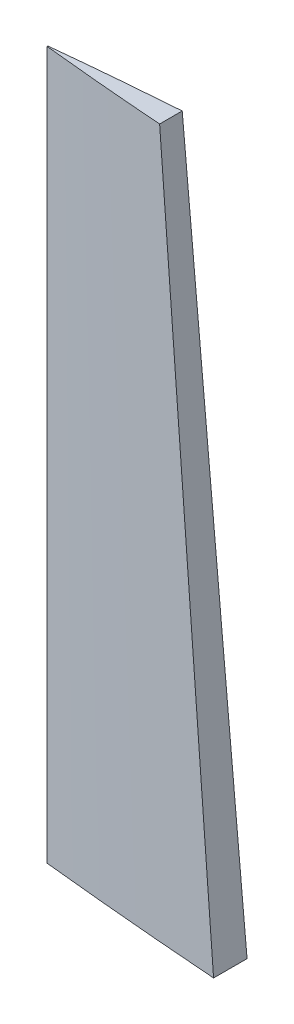
from build123d import *


with BuildPart() as part:
    # Sketch1 → Loft1 section 0
    with BuildSketch(Plane(origin=(0, 22, 0), x_dir=(1, 0, 0), z_dir=(0, 1, 0))):
        with BuildLine():
            Line((-118.135502225, 4.3944186), (-118.135502225, -4.3944186))
            add(Edge.make_bspline(
                [(-118.135502225, -4.3944186), (-118.315108728, -4.381745473), (-120.982126782, -4.193559311), (-125.988801881, -3.805827917), (-132.984553035, -3.247308976), (-139.466825908, -2.698900063), (-145.364928317, -2.17757587), (-150.614153959, -1.694193905), (-155.157010485, -1.26065266), (-158.943728274, -0.887942175), (-161.932835692, -0.586164771), (-164.091595882, -0.363872033), (-165.396382991, -0.227760289), (-165.978950192, -0.166519904), (-166.125, -0.151166918)],
                knots=[0, 0, 0, 0, 0.011211572, 0.166483201, 0.31268616, 0.448210553, 0.571562716, 0.681381362, 0.776452467, 0.855722863, 0.918312437, 0.963524724, 0.990855635, 1, 1, 1, 1], degree=3))
            Line((-166.125, -0.151166918), (-166.125, 0.151166918))
            add(Edge.make_bspline(
                [(-118.135502225, 4.3944186), (-118.315108728, 4.381745473), (-120.982126782, 4.193559311), (-125.988801881, 3.805827917), (-132.984553035, 3.247308976), (-139.466825908, 2.698900063), (-145.364928317, 2.17757587), (-150.614153959, 1.694193905), (-155.157010485, 1.26065266), (-158.943728274, 0.887942175), (-161.932835692, 0.586164771), (-164.091595882, 0.363872033), (-165.396382991, 0.227760289), (-165.978950192, 0.166519904), (-166.125, 0.151166918)],
                knots=[0, 0, 0, 0, 0.011211572, 0.166483201, 0.31268616, 0.448210553, 0.571562716, 0.681381362, 0.776452467, 0.855722863, 0.918312437, 0.963524724, 0.990855635, 1, 1, 1, 1], degree=3))
        make_face()
    # Sketch2 → Loft1 section 1
    with BuildSketch(Plane(origin=(0, 207.656, 0), x_dir=(1, 0, 0), z_dir=(0, 1, 0))):
        with BuildLine():
            Line((-133.730625, 2.966366614), (-133.730625, -2.966366614))
            add(Edge.make_bspline(
                [(-133.730625, -2.966366614), (-133.851864869, -2.957811867), (-135.652183417, -2.830780466), (-139.031841846, -2.569049947), (-143.754187292, -2.192032624), (-148.129919235, -1.821839877), (-152.111318293, -1.469930143), (-155.654705738, -1.14363257), (-158.72127248, -0.850979004), (-161.277422508, -0.599388056), (-163.295161203, -0.395679103), (-164.752390188, -0.245624723), (-165.633161291, -0.153745143), (-166.026411924, -0.112406016), (-166.125, -0.102042281)],
                knots=[0, 0, 0, 0, 0.011211572, 0.166483201, 0.31268616, 0.448210553, 0.571562716, 0.681381362, 0.776452467, 0.855722863, 0.918312437, 0.963524724, 0.990855635, 1, 1, 1, 1], degree=3))
            Line((-166.125, -0.102042281), (-166.125, 0.102042281))
            add(Edge.make_bspline(
                [(-133.730625, 2.966366614), (-133.851864869, 2.957811867), (-135.652183417, 2.830780466), (-139.031841846, 2.569049947), (-143.754187292, 2.192032624), (-148.129919235, 1.821839877), (-152.111318293, 1.469930143), (-155.654705738, 1.14363257), (-158.72127248, 0.850979004), (-161.277422508, 0.599388056), (-163.295161203, 0.395679103), (-164.752390188, 0.245624723), (-165.633161291, 0.153745143), (-166.026411924, 0.112406016), (-166.125, 0.102042281)],
                knots=[0, 0, 0, 0, 0.011211572, 0.166483201, 0.31268616, 0.448210553, 0.571562716, 0.681381362, 0.776452467, 0.855722863, 0.918312437, 0.963524724, 0.990855635, 1, 1, 1, 1], degree=3))
        make_face()
    loft()


solid = part.part
